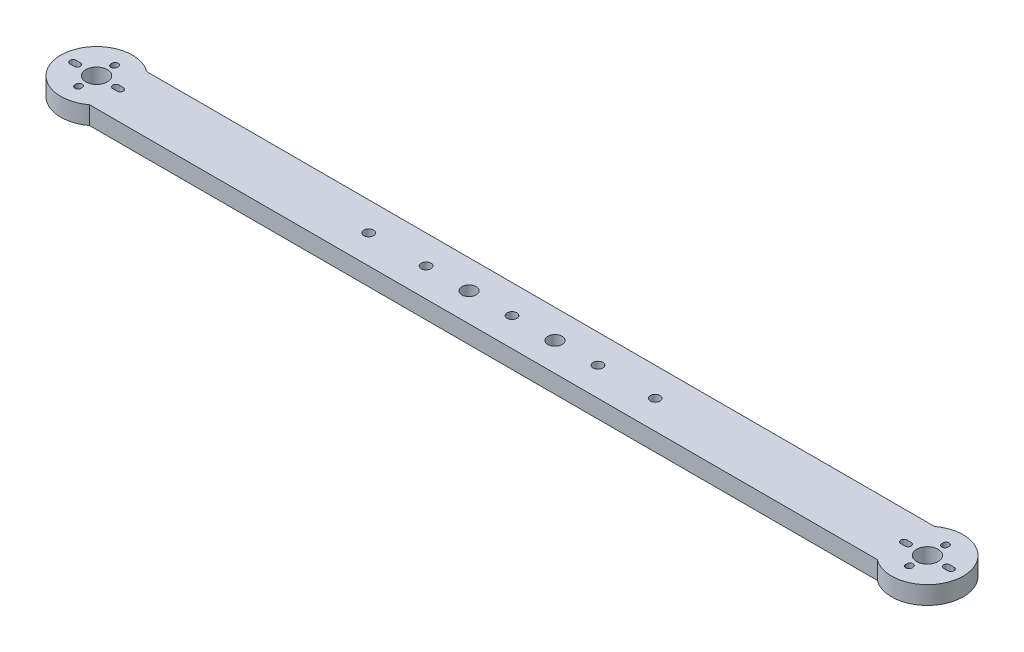
from build123d import *

# Parameters (mm, degrees)
BOSS_EXTRUDE1_DEPTH = 8
SKETCH2_R           = 4.75
CUT_EXTRUDE1_DEPTH  = 201.81338663
SKETCH3_R           = 2.159
CUT_EXTRUDE2_DEPTH  = 201.81338663
SKETCH4_R           = 3.175
CUT_EXTRUDE3_DEPTH  = 201.81338663
SKETCH5_R           = 2.159
CUT_EXTRUDE4_DEPTH  = 201.81338663


with BuildPart() as part:
    # Sketch1 → Boss-Extrude1 (new body)
    with BuildSketch(Plane(origin=(0, 0, 0), x_dir=(1, 0, 0), z_dir=(0, 1, 0))):
        with BuildLine():
            Line((-174.625, 12.7), (174.625, 12.7))
            ThreePointArc((174.625, 12.7), (200.025, 0), (174.625, -12.7))
            Line((174.625, -12.7), (-174.625, -12.7))
            ThreePointArc((-174.625, -12.7), (-200.025, 0), (-174.625, 12.7))
        make_face()
    extrude(amount=BOSS_EXTRUDE1_DEPTH)

    # Sketch2 → Cut-Extrude1 (cut, through all)
    with BuildSketch(Plane(origin=(0, 8, 0), x_dir=(1, 0, 0), z_dir=(0, 1, 0))):
        with Locations((184.15, 0)):
            Circle(SKETCH2_R)
        with Locations((-184.15, 0)):
            Circle(SKETCH2_R)
        with BuildLine():
            Line((173.691383345, 1.375), (175.608616655, 1.375))
            ThreePointArc((175.608616655, 1.375), (176.983616655, 0), (175.608616655, -1.375))
            Line((175.608616655, -1.375), (173.691383345, -1.375))
            ThreePointArc((173.691383345, -1.375), (172.316383345, 0), (173.691383345, 1.375))
        make_face()
        with BuildLine():
            Line((194.608616655, 1.375), (192.691383345, 1.375))
            ThreePointArc((192.691383345, 1.375), (191.316383345, 0), (192.691383345, -1.375))
            Line((192.691383345, -1.375), (194.608616655, -1.375))
            ThreePointArc((194.608616655, -1.375), (195.983616655, 0), (194.608616655, 1.375))
        make_face()
        with BuildLine():
            Line((185.525, 8.25), (185.525, 7.75))
            ThreePointArc((185.525, 7.75), (184.15, 6.375), (182.775, 7.75))
            Line((182.775, 7.75), (182.775, 8.25))
            ThreePointArc((182.775, 8.25), (184.15, 9.625), (185.525, 8.25))
        make_face()
        with BuildLine():
            Line((185.525, -8.25), (185.525, -7.75))
            ThreePointArc((185.525, -7.75), (184.15, -6.375), (182.775, -7.75))
            Line((182.775, -7.75), (182.775, -8.25))
            ThreePointArc((182.775, -8.25), (184.15, -9.625), (185.525, -8.25))
        make_face()
        with BuildLine():
            Line((-185.525, -8.25), (-185.525, -7.75))
            ThreePointArc((-185.525, -7.75), (-184.15, -6.375), (-182.775, -7.75))
            Line((-182.775, -7.75), (-182.775, -8.25))
            ThreePointArc((-182.775, -8.25), (-184.15, -9.625), (-185.525, -8.25))
        make_face()
        with BuildLine():
            Line((-185.525, 8.25), (-185.525, 7.75))
            ThreePointArc((-185.525, 7.75), (-184.15, 6.375), (-182.775, 7.75))
            Line((-182.775, 7.75), (-182.775, 8.25))
            ThreePointArc((-182.775, 8.25), (-184.15, 9.625), (-185.525, 8.25))
        make_face()
        with BuildLine():
            Line((-194.608616655, 1.375), (-192.691383345, 1.375))
            ThreePointArc((-192.691383345, 1.375), (-191.316383345, 0), (-192.691383345, -1.375))
            Line((-192.691383345, -1.375), (-194.608616655, -1.375))
            ThreePointArc((-194.608616655, -1.375), (-195.983616655, 0), (-194.608616655, 1.375))
        make_face()
        with BuildLine():
            Line((-173.691383345, 1.375), (-175.608616655, 1.375))
            ThreePointArc((-175.608616655, 1.375), (-176.983616655, 0), (-175.608616655, -1.375))
            Line((-175.608616655, -1.375), (-173.691383345, -1.375))
            ThreePointArc((-173.691383345, -1.375), (-172.316383345, 0), (-173.691383345, 1.375))
        make_face()
    extrude(amount=-CUT_EXTRUDE1_DEPTH, mode=Mode.SUBTRACT)

    # Sketch3 → Cut-Extrude2 (cut, through all)
    with BuildSketch(Plane(origin=(0, 8, 0), x_dir=(1, 0, 0), z_dir=(0, 1, 0))):
        Circle(SKETCH3_R)
        with Locations((38.1, 0)):
            Circle(SKETCH3_R)
        with Locations((-38.1, 0)):
            Circle(SKETCH3_R)
    extrude(amount=-CUT_EXTRUDE2_DEPTH, mode=Mode.SUBTRACT)

    # Sketch4 → Cut-Extrude3 (cut, through all)
    with BuildSketch(Plane(origin=(0, 8, 0), x_dir=(1, 0, 0), z_dir=(0, 1, 0))):
        with Locations((-19.05, 0)):
            Circle(SKETCH4_R)
        with Locations((19.05, 0)):
            Circle(SKETCH4_R)
    extrude(amount=-CUT_EXTRUDE3_DEPTH, mode=Mode.SUBTRACT)

    # Sketch5 → Cut-Extrude4 (cut, through all)
    with BuildSketch(Plane(origin=(0, 8, 0), x_dir=(1, 0, 0), z_dir=(0, 1, 0))):
        with Locations((63.5, 0)):
            Circle(SKETCH5_R)
        with Locations((-63.5, 0)):
            Circle(SKETCH5_R)
    extrude(amount=-CUT_EXTRUDE4_DEPTH, mode=Mode.SUBTRACT)


solid = part.part
